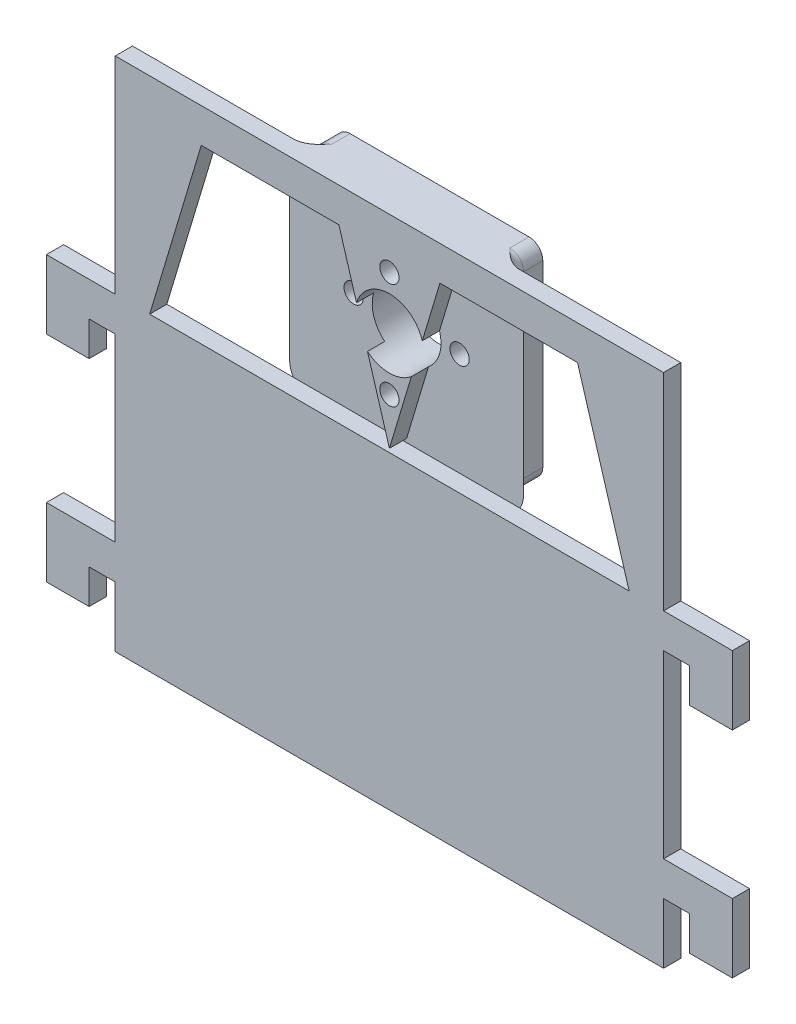
from build123d import *

# Parameters (mm, degrees)
SKETCH1_W           = 38.1
SKETCH1_H           = 38.1
BOSS_EXTRUDE1_DEPTH = 9.2583
SKETCH2_R           = 6.35
CUT_EXTRUDE1_DEPTH  = 10.8458
SKETCH3_R           = 1.778
CUT_EXTRUDE2_DEPTH  = 10.8458
CIRPATTERN1_COUNT   = 4
SKETCH4_W           = 31.5468
SKETCH4_H           = 95.2246
BOSS_EXTRUDE2_DEPTH = 3.175
SKETCH5_W           = 38.1
SKETCH5_H           = 57.1246
BOSS_EXTRUDE3_DEPTH = 3.175
FILLET1_R           = 2.54
FILLET2_R           = 2.54
BOSS_EXTRUDE4_DEPTH = 3.175
CUT_EXTRUDE3_DEPTH  = 4.7625


with BuildPart() as part:
    # Sketch1 → Boss-Extrude1 (new body)
    with BuildSketch(Plane.XY):
        with Locations((-19.05, -19.05)):
            Rectangle(SKETCH1_W, SKETCH1_H)
    extrude(amount=BOSS_EXTRUDE1_DEPTH)

    # Sketch2 → Cut-Extrude1 (cut)
    with BuildSketch(Plane.XY.offset(9.2583)):
        with Locations((-19.05, -19.05)):
            Circle(SKETCH2_R)
    extrude(amount=-CUT_EXTRUDE1_DEPTH, mode=Mode.SUBTRACT)

    # Sketch3 → Cut-Extrude2 (cut)
    with BuildSketch(Plane.XY.offset(9.2583)):
        with Locations((-19.05, -9.271)):
            Circle(SKETCH3_R)
    cut_extrude2 = extrude(amount=-CUT_EXTRUDE2_DEPTH, mode=Mode.SUBTRACT)

    # CirPattern1: Cut-Extrude2 ×4 about axis
    cirpattern1_axis = Axis((-19.05, -19.05, 0), (0, 0, 1))
    for i in range(1, CIRPATTERN1_COUNT):
        add(cut_extrude2.rotate(cirpattern1_axis, i * 360 / CIRPATTERN1_COUNT), mode=Mode.SUBTRACT)

    # Sketch4 → Boss-Extrude2 (add)
    with BuildSketch(Plane.XY.offset(9.2583)):
        with Locations((-53.8734, -47.6123)):
            Rectangle(SKETCH4_W, SKETCH4_H)
        with Locations((15.7734, -47.6123)):
            Rectangle(SKETCH4_W, SKETCH4_H)
    extrude(amount=-BOSS_EXTRUDE2_DEPTH)

    # Sketch5 → Boss-Extrude3 (add)
    with BuildSketch(Plane(origin=(0, 0, 6.0833), x_dir=(-1, 0, 0), z_dir=(0, 0, -1))):
        with Locations((19.05, -66.6623)):
            Rectangle(SKETCH5_W, SKETCH5_H)
    extrude(amount=-BOSS_EXTRUDE3_DEPTH)

    # Fillet1
    fillet1_edges = [part.edges().sort_by_distance(p)[0] for p in [
        (-38.1, -38.1, 3.04165),
        (-38.1, 0, 3.04165),
        (0, 0, 3.04165),
        (0, -38.1, 3.04165),
    ]]
    fillet(fillet1_edges, radius=FILLET1_R)

    # Fillet2
    # the kernel refuses this fillet: 2.54 mm, written as the material it adds along each edge
    with BuildSketch(Plane(origin=(-38.1, -35.56, 6.0833), x_dir=(0, 0, -1), z_dir=(0, 1, 0)), Plane(origin=(-2.54, -38.1, 6.0833), x_dir=(0, 0, -1), z_dir=(-1, 0, 0))) as fillet2_piece_1:
        with BuildLine():
            CenterArc((FILLET2_R, FILLET2_R), FILLET2_R, 180, 90)
            Line((0, FILLET2_R), (0, 0))
            Line((0, 0), (FILLET2_R, 0))
        make_face()
    extrude(amount=33.02)
    with BuildSketch(Plane(origin=(0, -35.56, 6.0833), x_dir=(0, 0, -1), z_dir=(0, 1, 0))) as fillet2_piece_2:
        with BuildLine():
            CenterArc((FILLET2_R, -FILLET2_R), FILLET2_R, 90, 90)
            Line((0, -FILLET2_R), (0, 0))
            Line((0, 0), (FILLET2_R, 0))
        make_face()
    extrude(amount=33.02)
    with BuildSketch(Plane(origin=(-35.56, -2.54, 6.0833), x_dir=(0.5976672776328278, -0.8017442392976482, 0), z_dir=(-0.8017442392976482, -0.5976672776328278, 0))) as fillet2_piece_3_section:
        with BuildLine():
            CenterArc((2.54 + FILLET2_R, -FILLET2_R), FILLET2_R, 90, 90)
            Line((2.54 + FILLET2_R, 0), (2.54, 0))
            Line((2.54, 0), (2.54, -FILLET2_R))
        make_face()
    fillet2_piece_3 = revolve(axis=Axis((-35.56, -2.54, 6.0833), (0, 0, 1)), revolution_arc=233.296989237, mode=Mode.PRIVATE)
    fillet2_piece_3 = split(fillet2_piece_3, bisect_by=Plane(origin=(-37.464844957, 0, 5.291764105), z_dir=(0, -1, 0)), keep=Keep.TOP, mode=Mode.PRIVATE)
    add(fillet2_piece_3)
    with BuildSketch(Plane(origin=(-35.56, -35.56, 6.0833), x_dir=(0, -1, 0), z_dir=(1, 0, 0))) as fillet2_piece_4:
        with BuildLine():
            CenterArc((2.54 + FILLET2_R, FILLET2_R), FILLET2_R, 180, 90)
            Line((2.54 + FILLET2_R, 0), (2.54, 0))
            Line((2.54, 0), (2.54, FILLET2_R))
        make_face()
    revolve(axis=Axis((-35.56, -35.56, 6.0833), (0, 0, -1)), revolution_arc=90)
    with BuildSketch(Plane(origin=(-2.54, -35.56, 6.0833), x_dir=(0, -1, 0), z_dir=(-1, 0, 0))) as fillet2_piece_5:
        with BuildLine():
            CenterArc((2.54 + FILLET2_R, -FILLET2_R), FILLET2_R, 90, 90)
            Line((2.54 + FILLET2_R, 0), (2.54, 0))
            Line((2.54, 0), (2.54, -FILLET2_R))
        make_face()
    revolve(axis=Axis((-2.54, -35.56, 6.0833), (0, 0, 1)), revolution_arc=90)
    with BuildSketch(Plane(origin=(-2.54, -2.54, 6.0833), x_dir=(-0.5976672776328275, -0.8017442392976483, 0), z_dir=(0.8017442392976483, -0.5976672776328275, 0))) as fillet2_piece_6_section:
        with BuildLine():
            CenterArc((2.54 + FILLET2_R, FILLET2_R), FILLET2_R, 180, 90)
            Line((2.54, FILLET2_R), (2.54, 0))
            Line((2.54, 0), (2.54 + FILLET2_R, 0))
        make_face()
    fillet2_piece_6 = revolve(axis=Axis((-2.54, -2.54, 6.0833), (0, 0, -1)), revolution_arc=233.296989237, mode=Mode.PRIVATE)
    fillet2_piece_6 = split(fillet2_piece_6, bisect_by=Plane(origin=(-0.63515521, 0, 5.291763812), z_dir=(0, -1, 0)), keep=Keep.TOP, mode=Mode.PRIVATE)
    add(fillet2_piece_6)

    # Sketch6 → Boss-Extrude4 (add)
    with BuildSketch(Plane(origin=(0, 0, 6.0833), x_dir=(-1, 0, 0), z_dir=(0, 0, -1))):
        Polygon((-36.3728, -50.8), (-44.2468, -50.8), (-44.2468, -38.1), (-31.5468, -38.1), (-31.5468, -44.45), (-36.3728, -44.45), align=None)
        Polygon((-36.3728, -90.424), (-44.2468, -90.424), (-44.2468, -77.724), (-31.5468, -77.724), (-31.5468, -84.074), (-36.3728, -84.074), align=None)
    boss_extrude4 = extrude(amount=-BOSS_EXTRUDE4_DEPTH)

    # Mirror2: Boss-Extrude4 across plane
    add(boss_extrude4.mirror(Plane(origin=(-19.05, 0, 0), x_dir=(0, 0, 1), z_dir=(1, 0, 0))))

    # Sketch8 → Cut-Extrude3 (cut)
    with BuildSketch(Plane(origin=(0, 0, 6.0833), x_dir=(-1, 0, 0), z_dir=(0, 0, -1))):
        Polygon((-25.1968, -38.1), (19.2532, -38.1), (9.7282, -6.35), (-15.6718, -6.35), align=None)
    cut_extrude3 = extrude(amount=-CUT_EXTRUDE3_DEPTH, mode=Mode.SUBTRACT)

    # Mirror3: Cut-Extrude3 across plane
    add(cut_extrude3.mirror(Plane(origin=(-19.05, 0, 0), x_dir=(0, 0, 1), z_dir=(1, 0, 0))), mode=Mode.SUBTRACT)


solid = part.part
